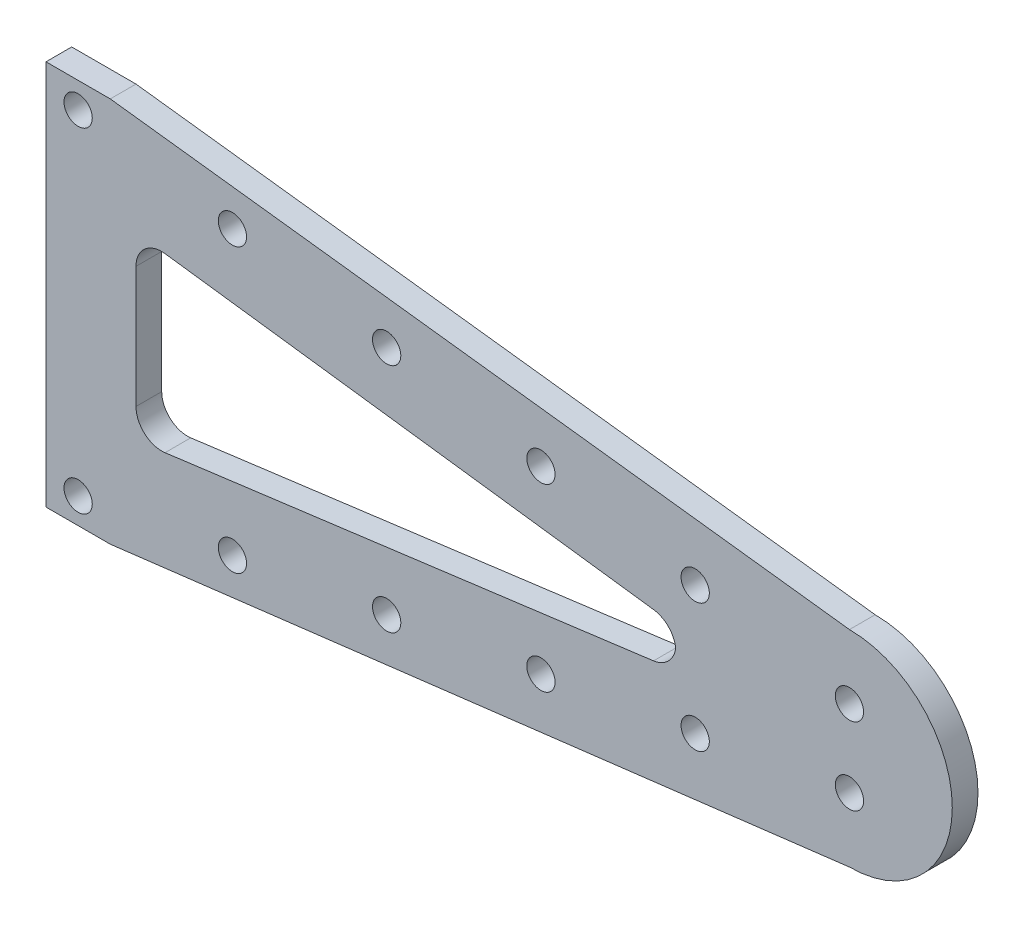
from build123d import *

# Parameters (mm, degrees)
SKETCH_1_R      = 1.1
EXTRUDE_1_DEPTH = 2
FILLET_1_R      = 2


with BuildPart() as part:
    # 草圖1 → 填料-伸長1 (new body)
    with BuildSketch(Plane.XY):
        with BuildLine():
            Line((2.5, 15), (60, 8))
            ThreePointArc((60, 8), (68, 0), (60, -8))
            Line((60, -8), (2.5, -15))
            Line((2.5, -15), (-2.5, -15))
            Line((-2.5, -15), (-2.5, 15))
            Line((-2.5, 15), (2.5, 15))
        make_face()
        with Locations((0, 13)):
            Circle(SKETCH_1_R, mode=Mode.SUBTRACT)
        with Locations((0, -13)):
            Circle(SKETCH_1_R, mode=Mode.SUBTRACT)
        with Locations((12, 11)):
            Circle(SKETCH_1_R, mode=Mode.SUBTRACT)
        with Locations((24, 9)):
            Circle(SKETCH_1_R, mode=Mode.SUBTRACT)
        with Locations((36, 7)):
            Circle(SKETCH_1_R, mode=Mode.SUBTRACT)
        with Locations((48, 5)):
            Circle(SKETCH_1_R, mode=Mode.SUBTRACT)
        with Locations((60, 3)):
            Circle(SKETCH_1_R, mode=Mode.SUBTRACT)
        with Locations(Location((60, -3, 0), (0, 0, 180))):
            Circle(SKETCH_1_R, mode=Mode.SUBTRACT)
        with Locations(Location((48, -5, 0), (0, 0, 180))):
            Circle(SKETCH_1_R, mode=Mode.SUBTRACT)
        with Locations(Location((36, -7, 0), (0, 0, 180))):
            Circle(SKETCH_1_R, mode=Mode.SUBTRACT)
        with Locations(Location((24, -9, 0), (0, 0, 180))):
            Circle(SKETCH_1_R, mode=Mode.SUBTRACT)
        with Locations(Location((12, -11, 0), (0, 0, 180))):
            Circle(SKETCH_1_R, mode=Mode.SUBTRACT)
        Polygon((4.5, 0), (4.5, 7), (46.5, 1.5), (46.5, -1.5), (4.5, -7), align=None, mode=Mode.SUBTRACT)
    extrude(amount=EXTRUDE_1_DEPTH)

    # 圓角1
    # the kernel refuses this fillet: 2 mm, written as the material it adds along each edge
    with BuildSketch(Plane(origin=(46.5, -1.5, 0), x_dir=(0, 1, 0), z_dir=(0, 0, 1)), Plane(origin=(46.5, 1.5, 0), x_dir=(-0.9915344613221523, 0.12984379850647185, 0), z_dir=(0, 0, 1))) as fillet_1_piece_1:
        with BuildLine():
            CenterArc((FILLET_1_R * 0.877585434936, FILLET_1_R), FILLET_1_R, 187.460566126, 82.539433874)
            Line((-FILLET_1_R * 0.113949026386, FILLET_1_R * 0.870156201494), (0, 0))
            Line((0, 0), (FILLET_1_R * 0.877585434936, 0))
        make_face()
    extrude(amount=2)
    with BuildSketch(Plane(origin=(4.5, -7, 0), x_dir=(0, 1, 0), z_dir=(0, 0, 1))) as fillet_1_piece_2:
        with BuildLine():
            CenterArc((FILLET_1_R * 1.13949019684, -FILLET_1_R), FILLET_1_R, 90, 97.460566126)
            Line((FILLET_1_R * 0.147955735519, -FILLET_1_R * 1.12984379851), (0, 0))
            Line((0, 0), (FILLET_1_R * 1.13949019684, 0))
        make_face()
    extrude(amount=2)
    with BuildSketch(Plane(origin=(4.5, 7, 0), x_dir=(0, -1, 0), z_dir=(0, 0, 1))) as fillet_1_piece_3:
        with BuildLine():
            CenterArc((FILLET_1_R * 1.13949019684, FILLET_1_R), FILLET_1_R, 172.539433874, 97.460566126)
            Line((FILLET_1_R * 0.147955735519, FILLET_1_R * 1.12984379851), (0, 0))
            Line((0, 0), (FILLET_1_R * 1.13949019684, 0))
        make_face()
    extrude(amount=2)


solid = part.part
